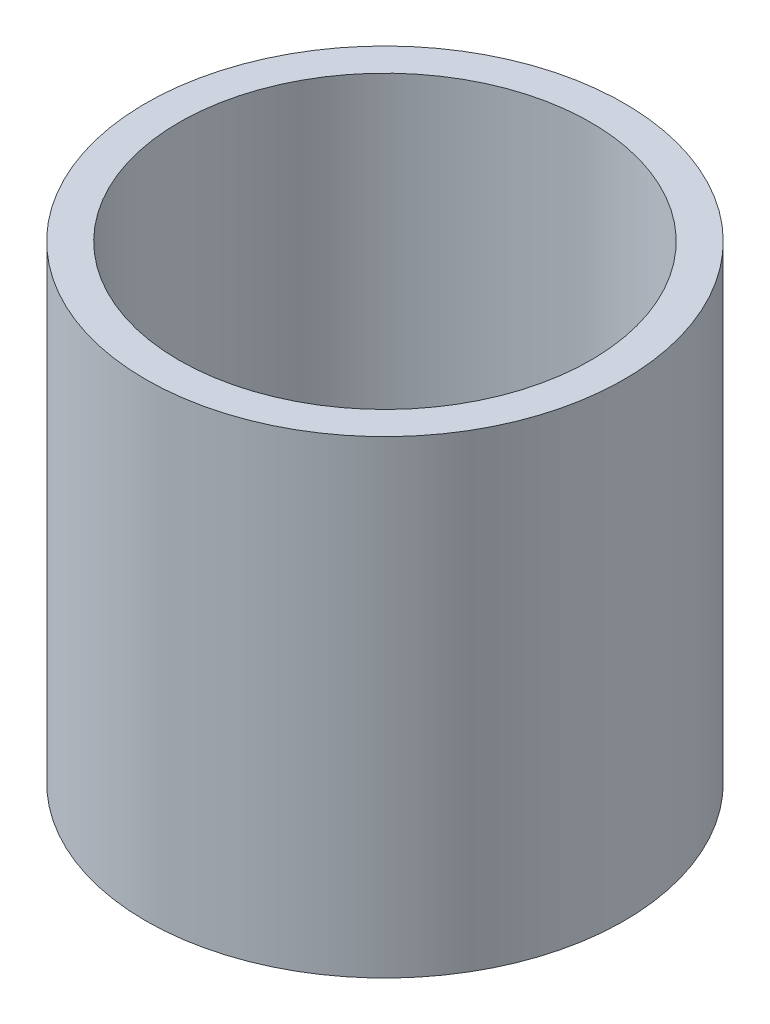
from build123d import *

# Parameters (mm, degrees)
SKETCH1_R           = 27.5
BOSS_EXTRUDE1_DEPTH = 53.899714252
SKETCH2_R           = 23.674850478
CUT_EXTRUDE1_DEPTH  = 67.465624171


with BuildPart() as part:
    # Sketch1 → Boss-Extrude1 (new body)
    with BuildSketch(Plane(origin=(0, 0, 0), x_dir=(1, 0, 0), z_dir=(0, 1, 0))):
        Circle(SKETCH1_R)
    extrude(amount=BOSS_EXTRUDE1_DEPTH)

    # Sketch2 → Cut-Extrude1 (cut, through all)
    with BuildSketch(Plane(origin=(0, 0, 0), x_dir=(1, 0, 0), z_dir=(0, 1, 0))):
        Circle(SKETCH2_R)
    extrude(amount=CUT_EXTRUDE1_DEPTH, mode=Mode.SUBTRACT)


solid = part.part
